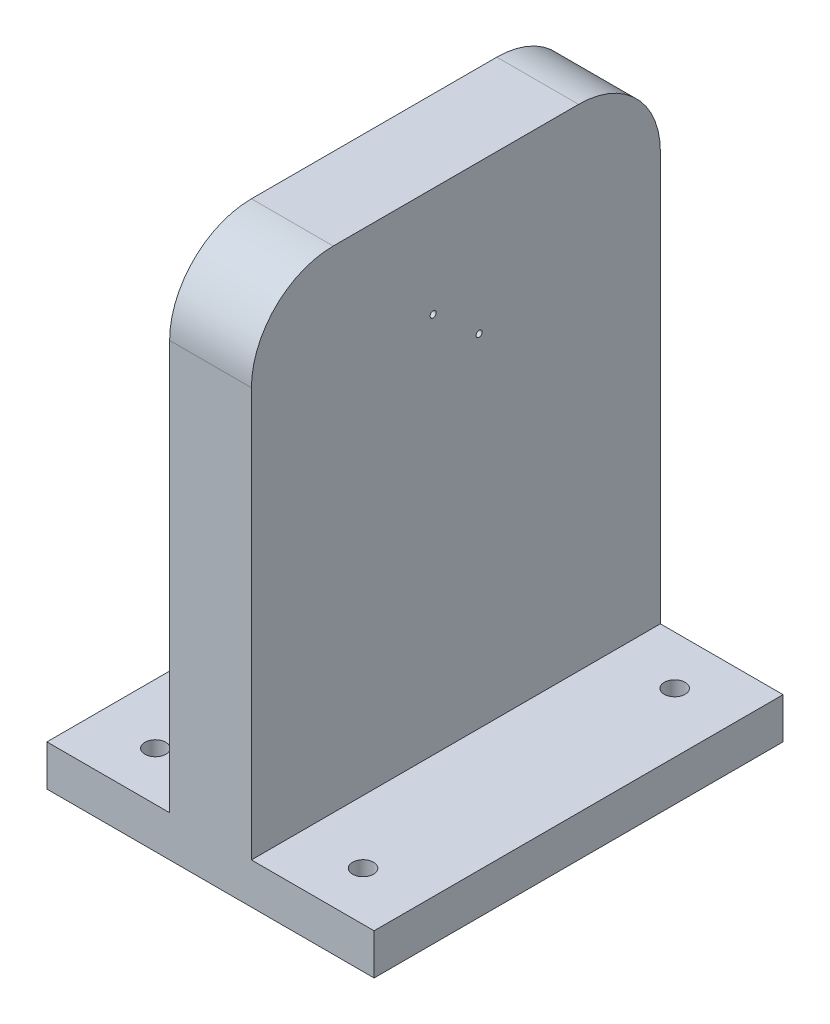
from build123d import *

# Parameters (mm, degrees)
SKETCH2_W           = 80
SKETCH2_H           = 100
BOSS_EXTRUDE1_DEPTH = 10
SKETCH3_W           = 20
SKETCH3_H           = 100
BOSS_EXTRUDE2_DEPTH = 120
SKETCH4_R           = 0.75
CUT_EXTRUDE1_DEPTH  = 55
SKETCH5_R           = 2.555
CUT_EXTRUDE2_DEPTH  = 55
FILLET2_R           = 20


with BuildPart() as part:
    # Sketch2 → Boss-Extrude1 (new body)
    with BuildSketch(Plane(origin=(0, 0, 0), x_dir=(1, 0, 0), z_dir=(0, 1, 0))):
        Rectangle(SKETCH2_W, SKETCH2_H)
    extrude(amount=BOSS_EXTRUDE1_DEPTH)

    # Sketch3 → Boss-Extrude2 (add)
    with BuildSketch(Plane(origin=(0, 10, 0), x_dir=(1, 0, 0), z_dir=(0, 1, 0))):
        Rectangle(SKETCH3_W, SKETCH3_H)
    extrude(amount=BOSS_EXTRUDE2_DEPTH)

    # Sketch4 → Cut-Extrude1 (cut)
    with BuildSketch(Plane.ZY.offset(10)):
        with Locations((-5.686185616, 93.587135628)):
            Circle(SKETCH4_R)
        with Locations((5.565748249, 103.308806487)):
            Circle(SKETCH4_R)
    extrude(amount=-CUT_EXTRUDE1_DEPTH, mode=Mode.SUBTRACT)

    # Sketch5 → Cut-Extrude2 (cut)
    with BuildSketch(Plane.XZ):
        with Locations((-25.4, -38.1)):
            Circle(SKETCH5_R)
        with Locations((25.4, -38.1)):
            Circle(SKETCH5_R)
        with Locations((-25.4, 38.1)):
            Circle(SKETCH5_R)
        with Locations((25.4, 38.1)):
            Circle(SKETCH5_R)
    extrude(amount=-CUT_EXTRUDE2_DEPTH, mode=Mode.SUBTRACT)

    # Fillet2
    fillet2_edges = [part.edges().sort_by_distance(p)[0] for p in [
        (0, 130, -50),
        (0, 130, 50),
    ]]
    fillet(fillet2_edges, radius=FILLET2_R)


solid = part.part
